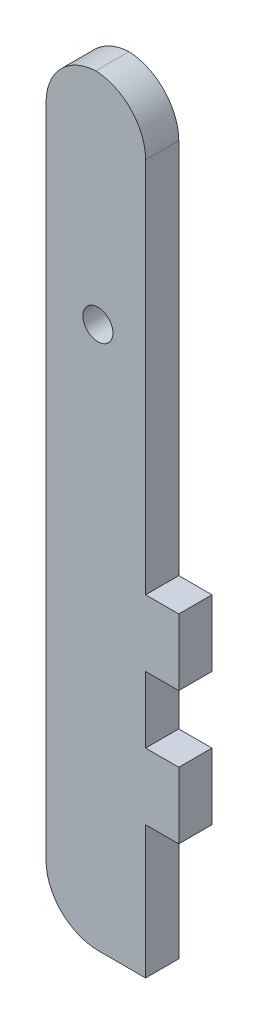
from build123d import *

# Parameters (mm, degrees)
BOSS_EXTRUDE1_DEPTH = 6.35
FILLET1_R           = 10
SKETCH2_R           = 2.8702
CUT_EXTRUDE3_DEPTH  = 120.57148989


with BuildPart() as part:
    # Sketch1 → Boss-Extrude1 (new body)
    with BuildSketch(Plane.XY):
        Polygon((-44.45, 19.05), (-44.45, 101.128885963), (-63.5, 101.128885963), (-63.5, -44.45), (-44.45, -44.45), (-44.45, -19.05), (-38.1, -19.05), (-38.1, -6.35), (-44.45, -6.35), (-44.45, 6.35), (-38.1, 6.35), (-38.1, 19.05), align=None)
    extrude(amount=BOSS_EXTRUDE1_DEPTH)

    # Fillet1
    # the kernel refuses this fillet: 10 mm, written as the material it takes off along each edge
    with BuildSketch(Plane(origin=(-63.5, -44.45, -25), x_dir=(0, 1, 0), z_dir=(0, 0, 1)), Plane(origin=(-44.45, 101.128885963, -25), x_dir=(0, -1, 0), z_dir=(0, 0, 1)), Plane(origin=(-63.5, 101.128885963, -25), x_dir=(1, 0, 0), z_dir=(0, 0, 1))) as fillet1_piece_1:
        with BuildLine():
            CenterArc((FILLET1_R, -FILLET1_R), FILLET1_R, 90, 90)
            Line((0, -FILLET1_R), (0, 0))
            Line((0, 0), (FILLET1_R, 0))
        make_face()
    extrude(amount=56.35, mode=Mode.SUBTRACT)

    # Sketch2 → Cut-Extrude3 (cut, through all)
    with BuildSketch(Plane(origin=(0, 0, 0), x_dir=(-1, 0, 0), z_dir=(0, 0, -1))):
        with Locations((53.575, 59.289941788)):
            Circle(SKETCH2_R)
    extrude(amount=-CUT_EXTRUDE3_DEPTH, mode=Mode.SUBTRACT)


solid = part.part
